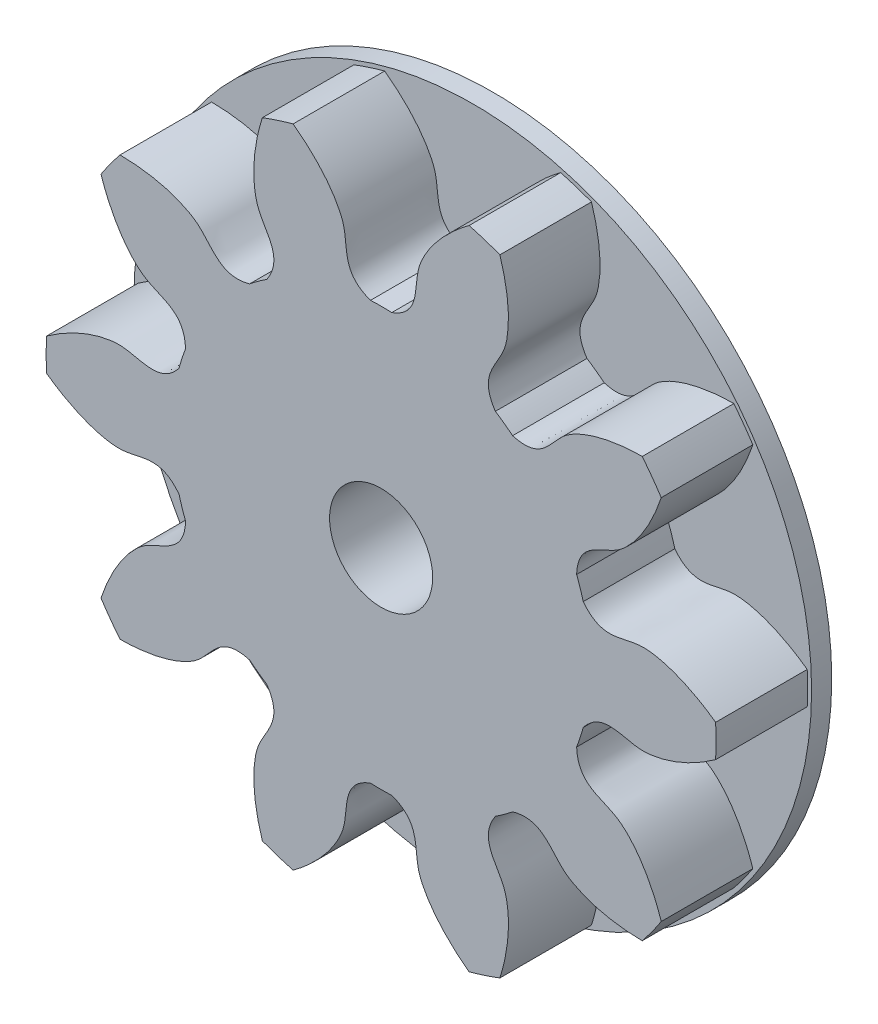
from build123d import *
from OCP.BRepAlgoAPI import BRepAlgoAPI_Cut
from OCP.TopTools import TopTools_ListOfShape

# Parameters (mm, degrees)
SKETCH_1_R               = 4.2
EXTRUDE_1_DEPTH          = 1.148648649
CUT_EXTRUDE_1_DEPTH      = 7.049743277
PATTERN_CIRCULAR_1_COUNT = 10
SCALE_1_SCALE            = 0.870588235
SKETCH_5_R               = 0.5625
CUT_EXTRUDE_2_DEPTH      = 6.178496957
SKETCH_7_R               = 3.7
EXTRUDE_3_DEPTH          = 0.22
SKETCH_8_R               = 0.5625
CUT_EXTRUDE_3_DEPTH      = 6.372932298


with BuildPart() as part:
    # 草图1 → 凸台-拉伸1 (new body)
    with BuildSketch(Plane.XY):
        Circle(SKETCH_1_R)
    extrude(amount=EXTRUDE_1_DEPTH)

    # 草图2 → 切除-拉伸1 (cut, through all)
    with BuildSketch(Plane.XY):
        with BuildLine():
            ThreePointArc((0.133320786, 2.621612208), (0, 2.625), (-0.133320786, 2.621612208))
            add(Edge.make_bspline(
                [(-0.133320786, 2.621612208), (-0.507801231, 2.75839773), (-0.401689087, 3.059412612), (-0.482063125, 3.307270788), (-0.48615212, 3.31908143), (-0.490931888, 3.33204237), (-0.496448876, 3.346130434), (-0.502750198, 3.361320759), (-0.509881851, 3.377587145), (-0.517889214, 3.394901969), (-0.526816842, 3.413236234), (-0.536708486, 3.432559585), (-0.547607038, 3.45284033), (-0.559554498, 3.474045459), (-0.57259194, 3.496140673), (-0.586759477, 3.519090404), (-0.602096224, 3.542857841), (-0.618640271, 3.567404956), (-0.636428642, 3.592692531), (-0.655497268, 3.618680184), (-0.675880955, 3.645326399), (-0.697613351, 3.672588554), (-0.720726917, 3.700422949), (-0.745252897, 3.728784843), (-0.771221292, 3.757628477), (-0.798660827, 3.786907111), (-0.827598929, 3.816573058), (-0.858061696, 3.846577712), (-0.890073877, 3.876871589), (-0.923658842, 3.907404354), (-0.958838561, 3.938124865), (-0.995633581, 3.968981202), (-1.034063002, 3.999920706), (-1.074144459, 4.030890018), (-1.115894098, 4.061835114), (-1.159326562, 4.092701346), (-1.204454964, 4.123433478), (-1.25129088, 4.153975727), (-1.299844325, 4.184271801), (-1.350123739, 4.214264942), (-1.402135975, 4.243897964), (-1.455886282, 4.273113296), (-1.511378297, 4.301853019), (-1.568614029, 4.330058916), (-1.627593849, 4.357672503), (-1.688316484, 4.384635082), (-1.750779006, 4.410887775), (-1.814976824, 4.436371573), (-1.880903679, 4.461027375), (-1.94855164, 4.484796032), (-2.017911096, 4.507618393), (-2.088970756, 4.529435346), (-2.161717647, 4.550187859), (-2.23613711, 4.569817032), (-2.312212804, 4.588264132), (-2.389926705, 4.605470641), (-2.469259108, 4.621378301), (-2.55018863, 4.635929154), (-2.632692218, 4.64906559), (-2.716745145, 4.660730388), (-2.831717355, 4.674348715), (-2.918884431, 4.682010857), (-2.977510639, 4.68600223)],
                knots=[0, 0, 0, 0, 0.201720712, 0.204696754, 0.208022917, 0.211699204, 0.215725612, 0.220102144, 0.224828797, 0.229905574, 0.235332472, 0.241109493, 0.247236637, 0.253713903, 0.260541292, 0.267718803, 0.275246437, 0.283124193, 0.291352071, 0.299930073, 0.308858196, 0.318136442, 0.327764811, 0.337743302, 0.348071916, 0.358750652, 0.36977951, 0.381158491, 0.392887595, 0.404966821, 0.41739617, 0.430175641, 0.443305234, 0.45678495, 0.470614789, 0.48479475, 0.499324833, 0.514205039, 0.529435368, 0.545015819, 0.560946392, 0.577227088, 0.593857907, 0.610838848, 0.628169911, 0.645851097, 0.663882406, 0.682263837, 0.70099539, 0.720077066, 0.739508864, 0.759290785, 0.779422829, 0.799904995, 0.820737283, 0.841919694, 0.863452227, 0.885334883, 0.907567662, 0.930150562, 0.953083586, 1, 1, 1, 1], degree=3))
            ThreePointArc((-2.977510639, 4.68600223), (0, 5.551953395), (2.977510639, 4.68600223))
            add(Edge.make_bspline(
                [(0.133320786, 2.621612208), (0.507801231, 2.75839773), (0.401689087, 3.059412612), (0.482063125, 3.307270788), (0.48615212, 3.31908143), (0.490931888, 3.33204237), (0.496448876, 3.346130434), (0.502750198, 3.361320759), (0.509881851, 3.377587145), (0.517889214, 3.394901969), (0.526816842, 3.413236234), (0.536708486, 3.432559585), (0.547607038, 3.45284033), (0.559554498, 3.474045459), (0.57259194, 3.496140673), (0.586759477, 3.519090404), (0.602096224, 3.542857841), (0.618640271, 3.567404956), (0.636428642, 3.592692531), (0.655497268, 3.618680184), (0.675880955, 3.645326399), (0.697613351, 3.672588554), (0.720726917, 3.700422949), (0.745252897, 3.728784843), (0.771221292, 3.757628477), (0.798660827, 3.786907111), (0.827598929, 3.816573058), (0.858061696, 3.846577712), (0.890073877, 3.876871589), (0.923658842, 3.907404354), (0.958838561, 3.938124865), (0.995633581, 3.968981202), (1.034063002, 3.999920706), (1.074144459, 4.030890018), (1.115894098, 4.061835114), (1.159326562, 4.092701346), (1.204454964, 4.123433478), (1.25129088, 4.153975727), (1.299844325, 4.184271801), (1.350123739, 4.214264942), (1.402135975, 4.243897964), (1.455886282, 4.273113296), (1.511378297, 4.301853019), (1.568614029, 4.330058916), (1.627593849, 4.357672503), (1.688316484, 4.384635082), (1.750779006, 4.410887775), (1.814976824, 4.436371573), (1.880903679, 4.461027375), (1.94855164, 4.484796032), (2.017911096, 4.507618393), (2.088970756, 4.529435346), (2.161717647, 4.550187859), (2.23613711, 4.569817032), (2.312212804, 4.588264132), (2.389926705, 4.605470641), (2.469259108, 4.621378301), (2.55018863, 4.635929154), (2.632692218, 4.64906559), (2.716745145, 4.660730388), (2.831717355, 4.674348715), (2.918884431, 4.682010857), (2.977510639, 4.68600223)],
                knots=[0, 0, 0, 0, 0.201720712, 0.204696754, 0.208022917, 0.211699204, 0.215725612, 0.220102144, 0.224828797, 0.229905574, 0.235332472, 0.241109493, 0.247236637, 0.253713903, 0.260541292, 0.267718803, 0.275246437, 0.283124193, 0.291352071, 0.299930073, 0.308858196, 0.318136442, 0.327764811, 0.337743302, 0.348071916, 0.358750652, 0.36977951, 0.381158491, 0.392887595, 0.404966821, 0.41739617, 0.430175641, 0.443305234, 0.45678495, 0.470614789, 0.48479475, 0.499324833, 0.514205039, 0.529435368, 0.545015819, 0.560946392, 0.577227088, 0.593857907, 0.610838848, 0.628169911, 0.645851097, 0.663882406, 0.682263837, 0.70099539, 0.720077066, 0.739508864, 0.759290785, 0.779422829, 0.799904995, 0.820737283, 0.841919694, 0.863452227, 0.885334883, 0.907567662, 0.930150562, 0.953083586, 1, 1, 1, 1], degree=3))
        make_face()
    cut_extrude_1 = extrude(amount=CUT_EXTRUDE_1_DEPTH, mode=Mode.SUBTRACT)

    # 阵列(圆周)1: 切除-拉伸1 ×10 about axis
    pattern_circular_1_axis = Axis((0, 0, -1.5), (0, 0, 1))
    for i in range(1, PATTERN_CIRCULAR_1_COUNT):
        add(cut_extrude_1.rotate(pattern_circular_1_axis, i * 360 / PATTERN_CIRCULAR_1_COUNT), mode=Mode.SUBTRACT)


with BuildPart() as part_1:
    # 缩放比例1: scaled about (1.289e-06, -4.44e-07, 0.574327076)
    add(part.part.scale(SCALE_1_SCALE).moved(Location((1.67e-07, -5.7e-08, 0.074324681))))


with BuildPart() as cut_extrude_2_tool:
    # 草图5 → 切除-拉伸2 (new, through all)
    with BuildSketch(Plane.XY.offset(1.074324324)):
        Circle(SKETCH_5_R)
    extrude(amount=-CUT_EXTRUDE_2_DEPTH)


with BuildPart() as part_2:
    add(part_1.part)

    # 切除-拉伸2: cut by cut_extrude_2_tool, with a tolerance
    cut_extrude_2_stock = TopTools_ListOfShape()
    cut_extrude_2_stock.Append(part_2.part.wrapped)
    cut_extrude_2_tools = TopTools_ListOfShape()
    cut_extrude_2_tools.Append(cut_extrude_2_tool.part.wrapped)
    cut_extrude_2_cut = BRepAlgoAPI_Cut()
    cut_extrude_2_cut.SetArguments(cut_extrude_2_stock)
    cut_extrude_2_cut.SetTools(cut_extrude_2_tools)
    cut_extrude_2_cut.SetFuzzyValue(0.00001)
    cut_extrude_2_cut.Build()
    add(Compound.cast(cut_extrude_2_cut.Shape()).solids(), mode=Mode.REPLACE)


with BuildPart() as extrude_3_tool:
    # 草图7 → 凸台-拉伸3 (new body)
    with BuildSketch(Plane(origin=(0, 0, 0.074324324), x_dir=(-1, 0, 0), z_dir=(0, 0, -1))):
        Circle(SKETCH_7_R)
    extrude(amount=EXTRUDE_3_DEPTH)


with BuildPart() as part_3:
    add(part_2.part)


with BuildPart() as part_4:
    # 凸台-拉伸3: joined with extrude_3_tool
    add(part_3.part.fuse(extrude_3_tool.part, tol=0.00001))

    # 草图8 → 切除-拉伸3 (cut, through all)
    with BuildSketch(Plane.XY.offset(1.074324324)):
        Circle(SKETCH_8_R)
    extrude(amount=-CUT_EXTRUDE_3_DEPTH, mode=Mode.SUBTRACT)


solid = part_4.part
